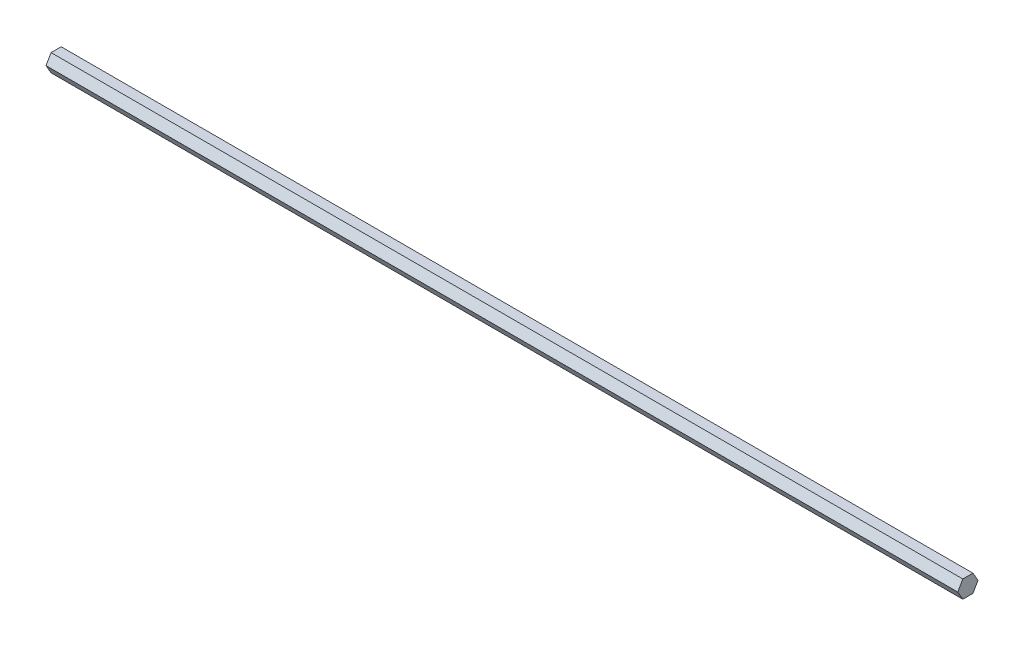
from build123d import *

# Parameters (mm, degrees)
BOSS_EXTRUDE1_DEPTH = 660.4


with BuildPart() as part:
    # Sketch1 → Boss-Extrude1 (new body)
    with BuildSketch(Plane(origin=(0, 0, 0), x_dir=(0, 0, -1), z_dir=(1, 0, 0))):
        Polygon((7.332348419, 0), (3.666174209, 6.35), (-3.666174209, 6.35), (-7.332348419, 0), (-3.666174209, -6.35), (3.666174209, -6.35), align=None)
    extrude(amount=BOSS_EXTRUDE1_DEPTH)


solid = part.part
